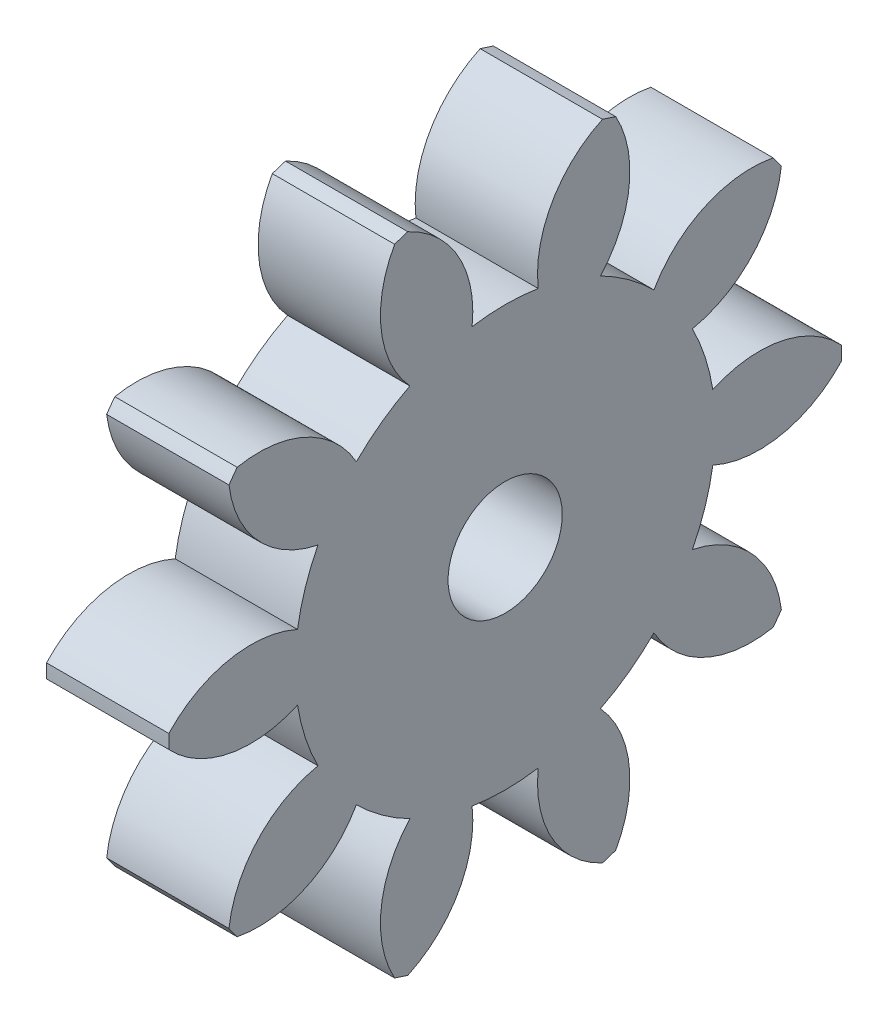
from build123d import *
from build123d.topology import SkipClean

# Parameters (mm, degrees)
BASPROSKE_W         = 2
BASPROSKE_H         = 8.25
TOOTHCUT_DEPTH      = 12.837440602
TEETHCUTS_COUNT     = 10
TEETHCUTS_ANGLE     = 324
BORSKE_R            = 2.5
BORE_DEPTH          = 50.0000508
SKETCH1_R           = 2.5
SKETCH1_R_2         = 1.4
BOSS_EXTRUDE1_DEPTH = 2
SKETCH2_R           = 2.8
SKETCH2_R_2         = 1.6
BOSS_EXTRUDE2_DEPTH = 1
CHAMFER1_SIZE       = 1.5
SKETCH3_R           = 1.5
BOSS_EXTRUDE3_DEPTH = 1
SKETCH4_R           = 1.6
SKETCH4_R_2         = 1.4
BOSS_EXTRUDE4_DEPTH = 1
BOSS_EXTRUDE5_START = 1
SKETCH5_R           = 1.5
SKETCH5_R_2         = 1.4
BOSS_EXTRUDE5_DEPTH = 1


with BuildPart() as part:
    # BasProSke → Base-Revolve (revolve)
    with BuildSketch(Plane(origin=(0, 0, 0), x_dir=(1, 0, 0), z_dir=(0, 1, 0)), mode=Mode.PRIVATE) as base_revolve_sk:
        with Locations((1, 4.125)):
            Rectangle(BASPROSKE_W, BASPROSKE_H)
    revolve(base_revolve_sk.sketch.rotate(Axis((-10, 0, 0), (1, 0, 0)), 180), axis=Axis((-10, 0, 0), (1, 0, 0)))

    # TooCutSke → ToothCut (cut, through all)
    with BuildSketch(Plane(origin=(0, 0, 0), x_dir=(0, 0, -1), z_dir=(1, 0, 0))):
        with BuildLine():
            ThreePointArc((0.810777273, 5.091094458), (0, 5.15525), (-0.810777273, 5.091094458))
            ThreePointArc((-0.810777273, 5.091094458), (-1.154893166, 6.765492881), (-2.421785774, 7.913102983))
            ThreePointArc((-2.421785774, 7.913102983), (0, 8.2754), (2.421785774, 7.913102983))
            ThreePointArc((2.421785774, 7.913102983), (1.154893166, 6.765492881), (0.810777273, 5.091094458))
        make_face()
    toothcut = extrude(amount=TOOTHCUT_DEPTH, mode=Mode.SUBTRACT)

    # TeethCuts: ToothCut ×10 about axis
    teethcuts_axis = Axis((-10, 0, 0), (1, 0, 0))
    for i in range(1, TEETHCUTS_COUNT):
        add(toothcut.rotate(teethcuts_axis, i * TEETHCUTS_ANGLE / (TEETHCUTS_COUNT - 1)), mode=Mode.SUBTRACT)

    # BorSke → Bore (cut, symmetric)
    with BuildSketch(Plane(origin=(0, 0, 0), x_dir=(0, 0, -1), z_dir=(1, 0, 0))):
        with Locations(Location((0, 0, 0), (0, 0, 180))):
            Circle(BORSKE_R)
    extrude(amount=BORE_DEPTH, both=True, mode=Mode.SUBTRACT)

    # Sketch1 → Boss-Extrude1 (add)
    with BuildSketch(Plane(origin=(2, 0, 0), x_dir=(0, 0, -1), z_dir=(1, 0, 0))):
        Circle(SKETCH1_R)
        Circle(SKETCH1_R_2, mode=Mode.SUBTRACT)
    extrude(amount=-BOSS_EXTRUDE1_DEPTH)

    # Sketch2 → Boss-Extrude2 (add)
    with BuildSketch(Plane.ZY):
        with Locations(Location((0, 0, 0), (0, 0, 180))):
            Circle(SKETCH2_R)
        Circle(SKETCH2_R_2, mode=Mode.SUBTRACT)
    extrude(amount=BOSS_EXTRUDE2_DEPTH)

    # Chamfer1
    # the kernel refuses this chamfer: 1.5 mm, written as the material it adds along each edge
    with BuildSketch(Plane(origin=(0, 0, 0), x_dir=(0, 0, -1), z_dir=(0, 1, 0))) as chamfer1_piece_1_section:
        Polygon((2.8 + CHAMFER1_SIZE, 0), (2.8, CHAMFER1_SIZE), (2.8, 0), align=None)
    chamfer1_piece_1 = revolve(axis=Axis((0, 0, 0), (-1, 0, 0)), mode=Mode.PRIVATE)
    chamfer1_piece_1 = split(chamfer1_piece_1, bisect_by=Plane(origin=(-1, 0, 3.801160136), z_dir=(1, 0, 0)), keep=Keep.TOP, mode=Mode.PRIVATE)
    add(chamfer1_piece_1)

    # Sketch3 → Boss-Extrude3 (add)
    with SkipClean():  # the faces are left unmerged after this step: merging them gives an invalid solid
        with BuildSketch(Plane(origin=(2, 0, 0), x_dir=(0, 0, -1), z_dir=(1, 0, 0))):
            with BuildLine():
                ThreePointArc((8.248240616, 0.170372351), (6.772423309, 0.99612057), (5.092462515, 0.802139699))
                ThreePointArc((5.092462515, 0.802139699), (4.902934106, 1.59305986), (4.591374603, 2.344329716))
                ThreePointArc((4.591374603, 2.344329716), (6.06451053, 3.174852073), (6.773109188, 4.710360064))
                ThreePointArc((6.773109188, 4.710360064), (6.674390204, 4.849228331), (6.572824477, 4.986028319))
                ThreePointArc((6.572824477, 4.986028319), (4.893500569, 4.786609013), (3.648402832, 3.642219012))
                ThreePointArc((3.648402832, 3.642219012), (3.030179922, 4.17068486), (2.336537648, 4.59534486))
                ThreePointArc((2.336537648, 4.59534486), (3.040160855, 6.133139134), (2.710880259, 7.791895034))
                ThreePointArc((2.710880259, 7.791895034), (2.549390204, 7.846216259), (2.386812789, 7.897190938))
                ThreePointArc((2.386812789, 7.897190938), (1.145426936, 6.748775503), (0.810777273, 5.091094458))
                ThreePointArc((0.810777273, 5.091094458), (0, 5.15525), (-0.810777273, 5.091094458))
                ThreePointArc((-0.810777273, 5.091094458), (-1.145426936, 6.748775503), (-2.386812789, 7.897190938))
                ThreePointArc((-2.386812789, 7.897190938), (-2.549390204, 7.846216259), (-2.710880259, 7.791895034))
                ThreePointArc((-2.710880259, 7.791895034), (-3.040160855, 6.133139134), (-2.336537648, 4.59534486))
                ThreePointArc((-2.336537648, 4.59534486), (-3.030179922, 4.17068486), (-3.648402832, 3.642219012))
                ThreePointArc((-3.648402832, 3.642219012), (-4.893500569, 4.786609013), (-6.572824477, 4.986028319))
                ThreePointArc((-6.572824477, 4.986028319), (-6.674390204, 4.849228331), (-6.773109188, 4.710360064))
                ThreePointArc((-6.773109188, 4.710360064), (-6.06451053, 3.174852073), (-4.591374603, 2.344329716))
                ThreePointArc((-4.591374603, 2.344329716), (-4.902934106, 1.59305986), (-5.092462515, 0.802139699))
                ThreePointArc((-5.092462515, 0.802139699), (-6.772423309, 0.99612057), (-8.248240616, 0.170372351))
                ThreePointArc((-8.248240616, 0.170372351), (-8.25, 0), (-8.248240616, -0.170372351))
                ThreePointArc((-8.248240616, -0.170372351), (-6.772423309, -0.99612057), (-5.092462515, -0.802139699))
                ThreePointArc((-5.092462515, -0.802139699), (-4.902934106, -1.59305986), (-4.591374603, -2.344329716))
                ThreePointArc((-4.591374603, -2.344329716), (-6.06451053, -3.174852073), (-6.773109188, -4.710360064))
                ThreePointArc((-6.773109188, -4.710360064), (-6.674390204, -4.849228331), (-6.572824477, -4.986028319))
                ThreePointArc((-6.572824477, -4.986028319), (-4.893500569, -4.786609013), (-3.648402832, -3.642219012))
                ThreePointArc((-3.648402832, -3.642219012), (-3.030179922, -4.17068486), (-2.336537648, -4.59534486))
                ThreePointArc((-2.336537648, -4.59534486), (-3.040160855, -6.133139134), (-2.710880259, -7.791895034))
                ThreePointArc((-2.710880259, -7.791895034), (-2.549390204, -7.846216259), (-2.386812789, -7.897190938))
                ThreePointArc((-2.386812789, -7.897190938), (-1.145426936, -6.748775503), (-0.810777273, -5.091094458))
                ThreePointArc((-0.810777273, -5.091094458), (0, -5.15525), (0.810777273, -5.091094458))
                ThreePointArc((0.810777273, -5.091094458), (1.145426936, -6.748775503), (2.386812789, -7.897190938))
                ThreePointArc((2.386812789, -7.897190938), (2.549390204, -7.846216259), (2.710880259, -7.791895034))
                ThreePointArc((2.710880259, -7.791895034), (3.040160855, -6.133139134), (2.336537648, -4.59534486))
                ThreePointArc((2.336537648, -4.59534486), (3.030179922, -4.17068486), (3.648402832, -3.642219012))
                ThreePointArc((3.648402832, -3.642219012), (4.893500569, -4.786609013), (6.572824477, -4.986028319))
                ThreePointArc((6.572824477, -4.986028319), (6.674390204, -4.849228331), (6.773109188, -4.710360064))
                ThreePointArc((6.773109188, -4.710360064), (6.06451053, -3.174852073), (4.591374603, -2.344329716))
                ThreePointArc((4.591374603, -2.344329716), (4.902934106, -1.59305986), (5.092462515, -0.802139699))
                ThreePointArc((5.092462515, -0.802139699), (6.772423309, -0.99612057), (8.248240616, -0.170372351))
                ThreePointArc((8.248240616, -0.170372351), (8.25, 0), (8.248240616, 0.170372351))
            make_face()
            Circle(SKETCH3_R, mode=Mode.SUBTRACT)
        extrude(amount=BOSS_EXTRUDE3_DEPTH)

    # Sketch4 → Boss-Extrude4 (add)
    with SkipClean():  # the faces are left unmerged after this step: merging them gives an invalid solid
        with BuildSketch(Plane.ZY):
            Circle(SKETCH4_R)
            with Locations(Location((0, 0, 0), (0, 0, 180))):
                Circle(SKETCH4_R_2, mode=Mode.SUBTRACT)
        extrude(amount=BOSS_EXTRUDE4_DEPTH)

    # Sketch5 → Boss-Extrude5 (add)
    with SkipClean():  # the faces are left unmerged after this step: merging them gives an invalid solid
        with BuildSketch(Plane(origin=(2, 0, 0), x_dir=(0, 0, -1), z_dir=(1, 0, 0)).offset(BOSS_EXTRUDE5_START)):
            Circle(SKETCH5_R)
            Circle(SKETCH5_R_2, mode=Mode.SUBTRACT)
        extrude(amount=-BOSS_EXTRUDE5_DEPTH)


solid = part.part
